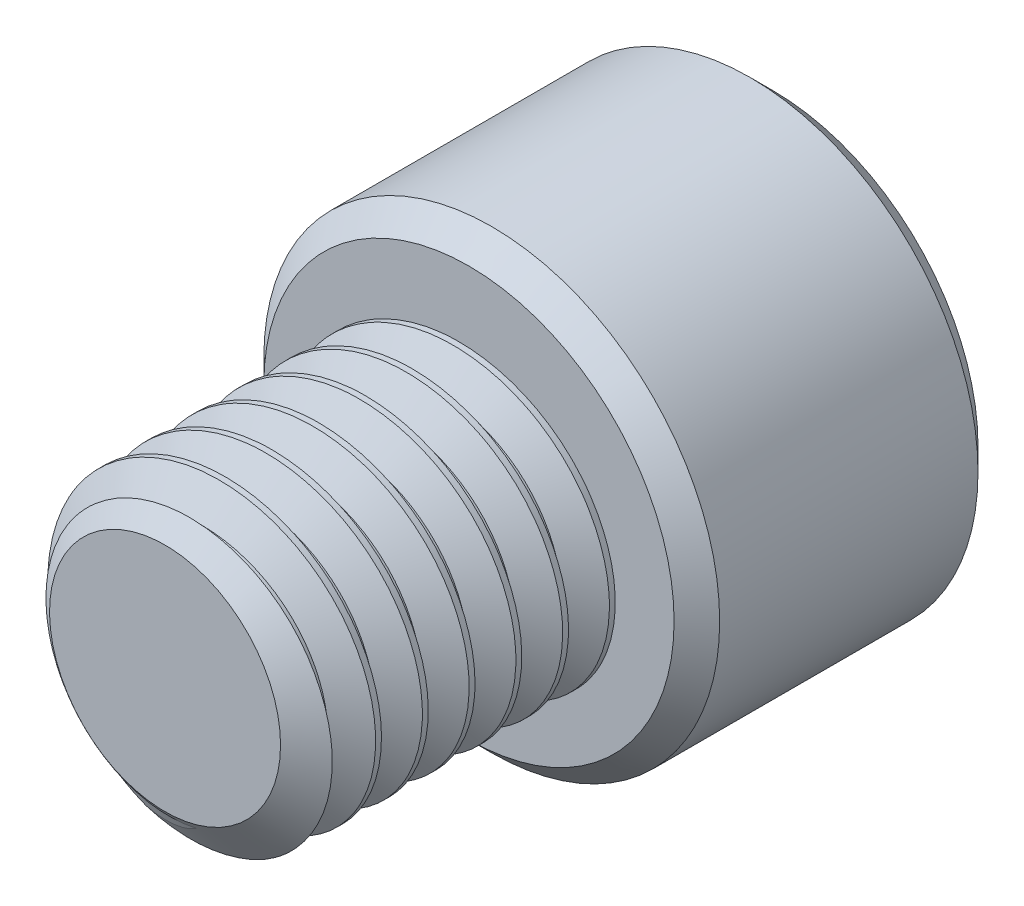
from build123d import *

# Parameters (mm, degrees)
SKETCH1_R          = 6.35
EXTRUDE1_DEPTH     = 12.7
CUT_SWEEP1_PITCH   = 1.953846154
SKETCH6_R          = 9.525
EXTRUDE2_DEPTH     = 12.7
CUT_EXTRUDE1_DEPTH = 7.14375
CHAMFER1_SIZE      = 0.9525


with BuildPart() as part:
    # Sketch1 → Extrude1 (new body)
    with BuildSketch(Plane.XY):
        Circle(SKETCH1_R)
    extrude(amount=-EXTRUDE1_DEPTH)

    # Cut-Sweep1: the profile of Sketch3 profile screwed along a right-hand helix of 7.5 turns, 6 arcs to a turn; built about Z, then put on its axis
    cut_sweep1_z = Axis((0, 0, 0), (0, 0, 1))
    cut_sweep1_corners = [(6.3503, 0, -1.70978859), (5.080939697, 0, -0.976923077), (5.080939697, 0, -0.732692308), (6.3503, 0, 0.000173205)]
    with BuildLine(mode=Mode.PRIVATE) as cut_sweep1_profile:
        Line(cut_sweep1_corners[0], cut_sweep1_corners[1])
        Line(cut_sweep1_corners[1], cut_sweep1_corners[2])
        Line(cut_sweep1_corners[2], cut_sweep1_corners[3])
        Line(cut_sweep1_corners[3], cut_sweep1_corners[0])
    cut_sweep1_cap = Face(cut_sweep1_profile.wire())
    cut_sweep1_turn_angles = [0, 30, 60, 90, 120, 150, 180, 210, 240, 270, 300, 330, 360]
    cut_sweep1_turn_weights = [1, 0.8660254037844387, 1, 0.8660254037844387, 1, 0.8660254037844387, 1, 0.8660254037844387, 1, 0.8660254037844387, 1, 0.8660254037844387, 1]
    cut_sweep1_turn_rails = [Edge.make_bspline([Vector(p[0], p[1], 0).rotate(cut_sweep1_z, cut_sweep1_turn_angles[k]) / cut_sweep1_turn_weights[k] + Vector(0, 0, p[2] + CUT_SWEEP1_PITCH * cut_sweep1_turn_angles[k] / 360) for k in range(13)], [0, 0, 0, 1, 1, 2, 2, 3, 3, 4, 4, 5, 5, 6, 6, 6], 2, cut_sweep1_turn_weights) for p in cut_sweep1_corners]
    cut_sweep1_turn_sides = [Face.make_surface_from_curves(cut_sweep1_turn_rails[p[0]], cut_sweep1_turn_rails[p[1]]) for p in [(0, 1), (1, 2), (2, 3), (3, 0)]]
    cut_sweep1_last_angles = [2520, 2550, 2580, 2610, 2640, 2670, 2700]
    cut_sweep1_last_weights = [1, 0.8660254037844387, 1, 0.8660254037844387, 1, 0.8660254037844168, 1]
    cut_sweep1_last_rails = [Edge.make_bspline([Vector(p[0], p[1], 0).rotate(cut_sweep1_z, cut_sweep1_last_angles[k]) / cut_sweep1_last_weights[k] + Vector(0, 0, p[2] + CUT_SWEEP1_PITCH * cut_sweep1_last_angles[k] / 360) for k in range(7)], [0, 0, 0, 1, 1, 2, 2, 3, 3, 3], 2, cut_sweep1_last_weights) for p in cut_sweep1_corners]
    cut_sweep1_last_sides = [Face.make_surface_from_curves(cut_sweep1_last_rails[p[0]], cut_sweep1_last_rails[p[1]]) for p in [(0, 1), (1, 2), (2, 3), (3, 0)]]
    cut_sweep1 = Plane(origin=(0, 0, 0), x_dir=(0, 1, 0), z_dir=(0, 0, -1)) * Solid(Shell([*[p.moved(Location((0, 0, CUT_SWEEP1_PITCH * i))) for i in range(7) for p in cut_sweep1_turn_sides], *cut_sweep1_last_sides, cut_sweep1_cap, cut_sweep1_cap.rotate(cut_sweep1_z, 2700).moved(Location((0, 0, CUT_SWEEP1_PITCH * 2700 / 360)))]))
    add(cut_sweep1, mode=Mode.SUBTRACT)

    # Sketch4 → Cut-Revolve1 (revolve, cut)
    with BuildSketch(Plane(origin=(0, 0, 0), x_dir=(0, 0, -1), z_dir=(1, 0, 0)), mode=Mode.PRIVATE) as cut_revolve1_sk:
        Polygon((1.066458305, 6.35), (0, 4.826939697), (0, 6.35), align=None)
    revolve(cut_revolve1_sk.sketch.rotate(Axis((0, 0, 0), (0, 0, -1)), 212.645821127), axis=Axis((0, 0, 0), (0, 0, -1)), mode=Mode.SUBTRACT)

    # Sketch6 → Extrude2 (add)
    with BuildSketch(Plane(origin=(0, 0, -12.7), x_dir=(-1, 0, 0), z_dir=(0, 0, -1))):
        Circle(SKETCH6_R)
    extrude(amount=EXTRUDE2_DEPTH)

    # Sketch7 → Cut-Extrude1 (cut)
    with BuildSketch(Plane(origin=(0, 0, -25.4), x_dir=(-1, 0, 0), z_dir=(0, 0, -1))):
        Polygon((0, 5.499261314), (-4.7625, 2.749630657), (-4.7625, -2.749630657), (0, -5.499261314), (4.7625, -2.749630657), (4.7625, 2.749630657), align=None)
    extrude(amount=-CUT_EXTRUDE1_DEPTH, mode=Mode.SUBTRACT)

    # Cut-Extrude2 cone 1 section (through the dimple's axis) → Cut-Extrude2 (revolve, cut)
    with BuildSketch(Plane(origin=(0, 0, -25.4), x_dir=(0, 1, 0), z_dir=(1, 0, 0))):
        Polygon((0, 0), (5.499261314, 0), (0, 5.499261314), align=None)
    revolve(axis=Axis((0, 0, -25.4), (0, 0, 1)), mode=Mode.SUBTRACT)

    # Chamfer1
    chamfer1_edges = [part.edges().sort_by_distance(p)[0] for p in [
        (9.525, 0, -12.7),
        (9.525, 0, -25.4),
    ]]
    chamfer(chamfer1_edges, length=CHAMFER1_SIZE)


solid = part.part
